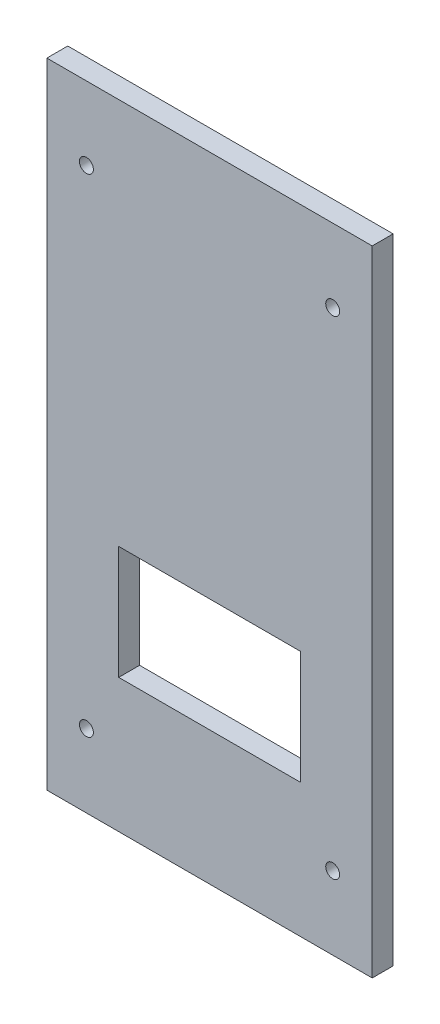
from build123d import *

# Parameters (mm, degrees)
SKETCH2_W           = 46.7
SKETCH2_H           = 91
SKETCH2_R           = 1
SKETCH2_W_2         = 26.073503968
SKETCH2_H_2         = 16.277986644
BOSS_EXTRUDE1_DEPTH = 3


with BuildPart() as part:
    # Sketch2 → Boss-Extrude1 (new body)
    with BuildSketch(Plane.XY):
        Rectangle(SKETCH2_W, SKETCH2_H)
        with Locations((17.675, 35)):
            Circle(SKETCH2_R, mode=Mode.SUBTRACT)
        with Locations((-17.675, 35)):
            Circle(SKETCH2_R, mode=Mode.SUBTRACT)
        with Locations((-17.675, -35)):
            Circle(SKETCH2_R, mode=Mode.SUBTRACT)
        with Locations((17.675, -35)):
            Circle(SKETCH2_R, mode=Mode.SUBTRACT)
        with Locations((0, -18.185085705)):
            Rectangle(SKETCH2_W_2, SKETCH2_H_2, mode=Mode.SUBTRACT)
    extrude(amount=BOSS_EXTRUDE1_DEPTH)


solid = part.part
